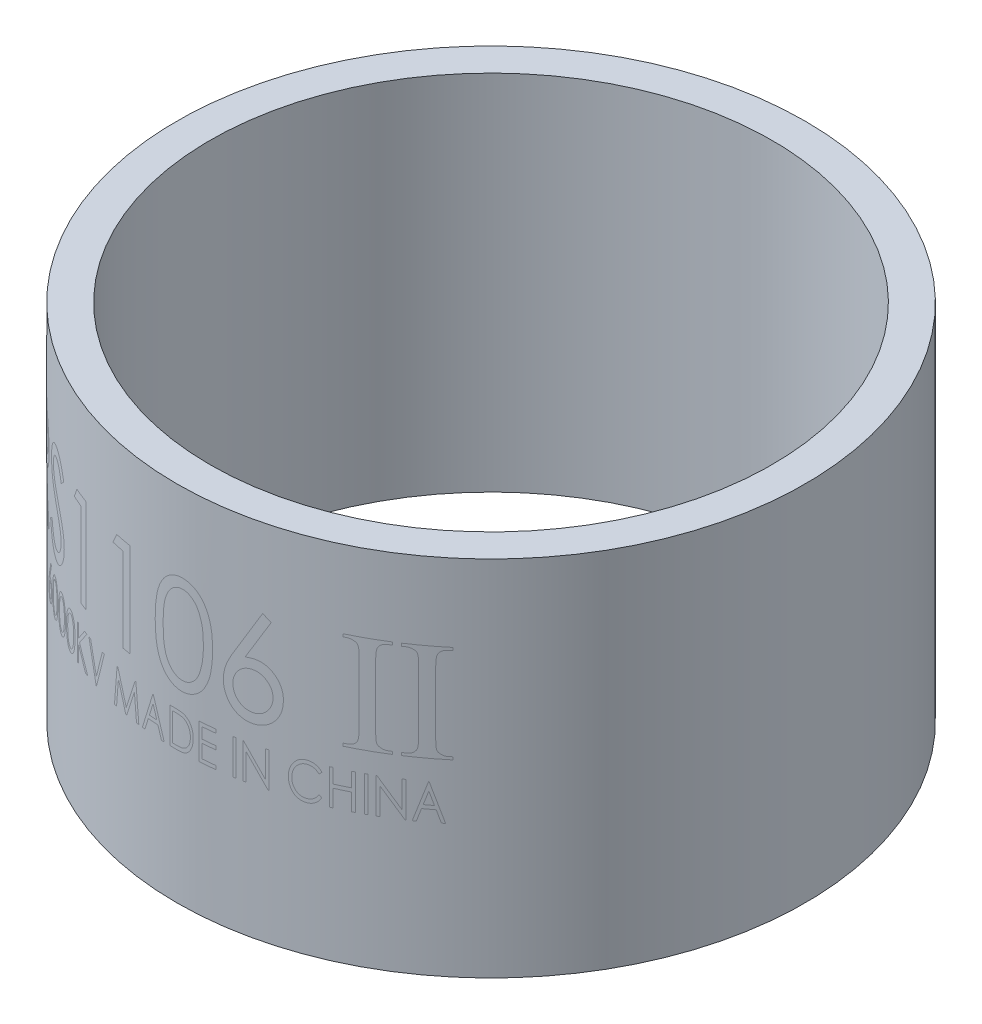
from build123d import *

# Parameters (mm, degrees)
SKETCH1_R           = 7.1
SKETCH1_R_2         = 6.35
BOSS_EXTRUDE1_DEPTH = 8.2


with BuildPart() as part:
    # Sketch1 → Boss-Extrude1 (new body)
    with BuildSketch(Plane(origin=(0, 0, 0), x_dir=(1, 0, 0), z_dir=(0, 1, 0))):
        Circle(SKETCH1_R)
        Circle(SKETCH1_R_2, mode=Mode.SUBTRACT)
    extrude(amount=BOSS_EXTRUDE1_DEPTH)


solid = part.part
